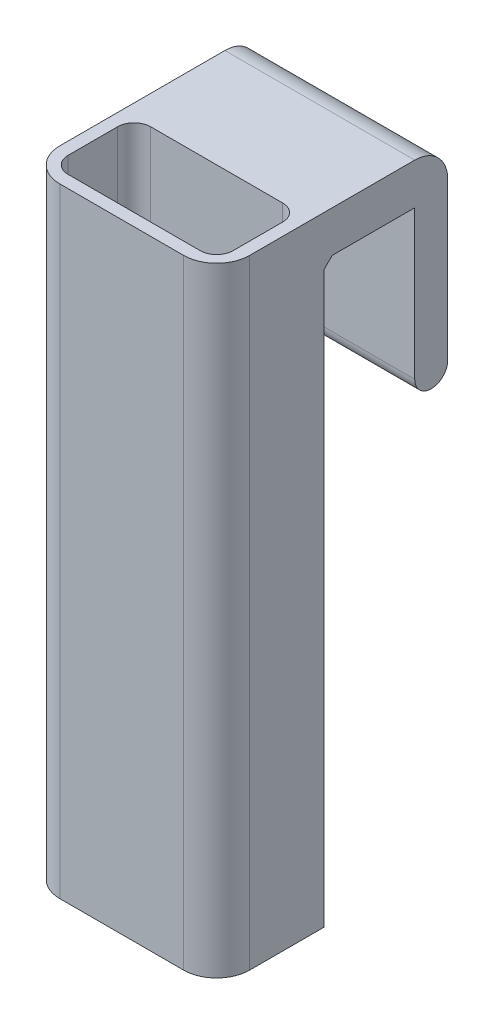
from build123d import *

# Parameters (mm, degrees)
BOSS_EXTRUDE1_DEPTH = 23
SKETCH3_W           = 20
SKETCH3_H           = 10
CUT_EXTRUDE1_DEPTH  = 73
CHAMFER1_SIZE       = 1
FILLET1_R           = 4
FILLET2_R           = 2
FILLET3_R           = 4
FILLET4_R           = 2


with BuildPart() as part:
    # Sketch2 → Boss-Extrude1 (new body)
    with BuildSketch(Plane(origin=(0, 0, 0), x_dir=(0, 0, -1), z_dir=(1, 0, 0))):
        Polygon((0, 0), (13, 0), (13, 70), (24, 70), (24, 50), (28, 50), (28, 75), (0, 75), align=None)
    extrude(amount=BOSS_EXTRUDE1_DEPTH)

    # Sketch3 → Cut-Extrude1 (cut)
    with BuildSketch(Plane(origin=(0, 75, 0), x_dir=(1, 0, 0), z_dir=(0, 1, 0))):
        with Locations((11.5, 6.5)):
            Rectangle(SKETCH3_W, SKETCH3_H)
    extrude(amount=-CUT_EXTRUDE1_DEPTH, mode=Mode.SUBTRACT)

    # Chamfer1
    chamfer1_edges = [part.edges().sort_by_distance(p)[0] for p in [
        (11.5, 70, -13),
    ]]
    chamfer(chamfer1_edges, length=CHAMFER1_SIZE)

    # Fillet1
    fillet1_edges = [part.edges().sort_by_distance(p)[0] for p in [
        (0, 37.5, 0),
        (23, 37.5, 0),
    ]]
    fillet(fillet1_edges, radius=FILLET1_R)

    # Fillet2
    fillet2_edges = [part.edges().sort_by_distance(p)[0] for p in [
        (1.5, 38.5, -11.5),
        (21.5, 38.5, -11.5),
        (21.5, 38.5, -1.5),
        (1.5, 38.5, -1.5),
    ]]
    fillet(fillet2_edges, radius=FILLET2_R)

    # Fillet3
    fillet3_edges = [part.edges().sort_by_distance(p)[0] for p in [
        (11.5, 75, -28),
    ]]
    fillet(fillet3_edges, radius=FILLET3_R)

    # Fillet4
    fillet4_edges = [part.edges().sort_by_distance(p)[0] for p in [
        (11.5, 50, -28),
        (11.5, 50, -24),
    ]]
    fillet(fillet4_edges, radius=FILLET4_R - 0.0001)  # a hair under: the kernel refuses the full size


solid = part.part
